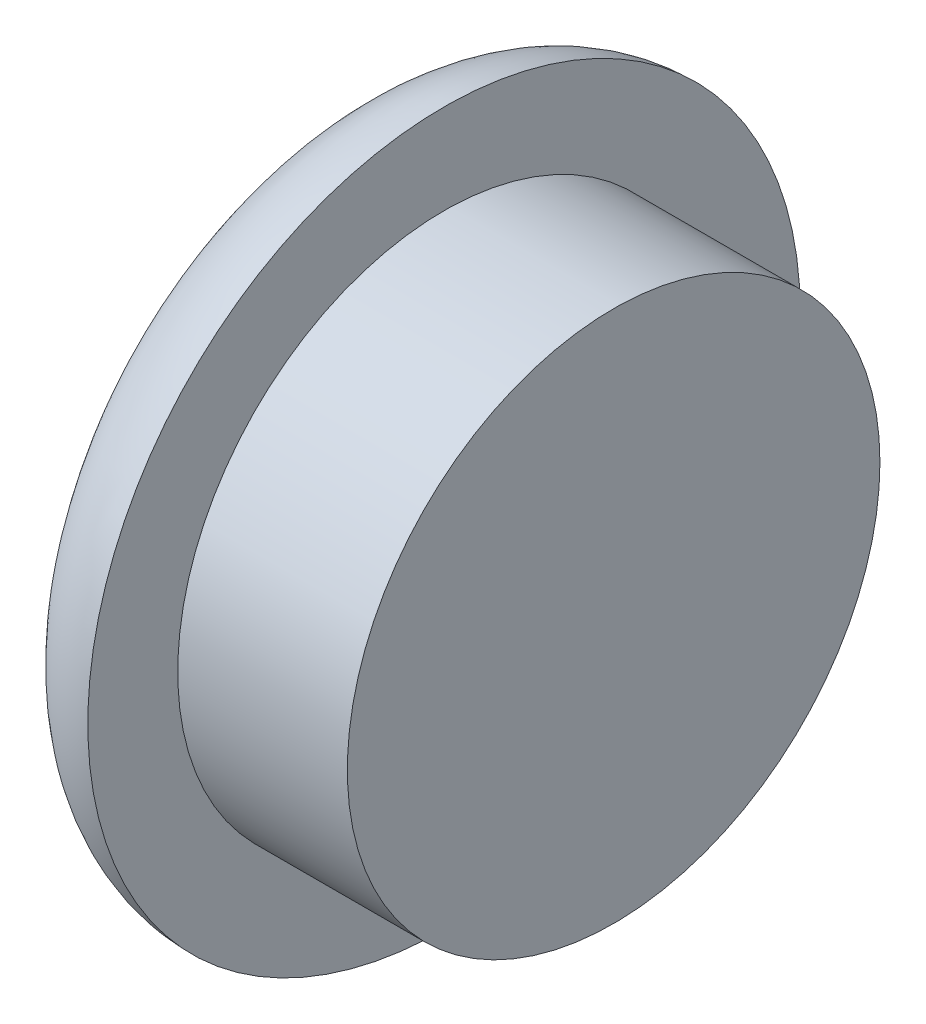
from build123d import *

# Parameters (mm, degrees)
SKETCH1_R           = 7.85
BOSS_EXTRUDE1_DEPTH = 5
SKETCH1_3_R         = 10.5
BOSS_EXTRUDE2_DEPTH = 3
FILLET1_R           = 3


with BuildPart() as part:
    # Sketch1 → Boss-Extrude1 (new body)
    with BuildSketch(Plane(origin=(0, 0, 0), x_dir=(0, 0, -1), z_dir=(1, 0, 0))):
        Circle(SKETCH1_R)
    extrude(amount=BOSS_EXTRUDE1_DEPTH)

    # Sketch1<3> → Boss-Extrude2 (add)
    with BuildSketch(Plane(origin=(0, 0, 0), x_dir=(0, 0, -1), z_dir=(1, 0, 0))):
        Circle(SKETCH1_3_R)
    extrude(amount=-BOSS_EXTRUDE2_DEPTH)

    # Fillet1
    fillet1_edges = [part.edges().sort_by_distance(p)[0] for p in [
        (-3, 0, 10.5),
    ]]
    fillet(fillet1_edges, radius=FILLET1_R - 0.0001)  # a hair under: the kernel refuses the full size


solid = part.part
